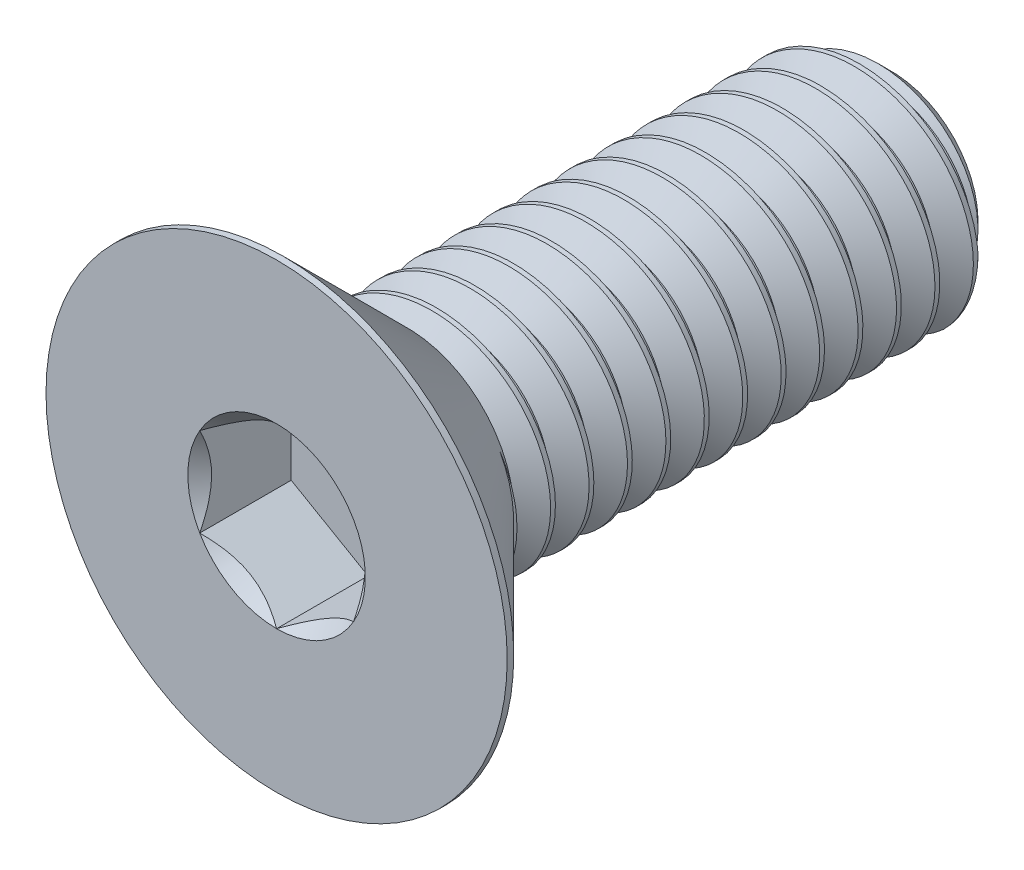
from build123d import *

# Parameters (mm, degrees)
CHAMFER1_SIZE      = 0.375
CUT_EXTRUDE2_DEPTH = 1.19
CUT_SWEEP1_PITCH   = 0.5


with BuildPart() as part:
    # Sketch1 → Revolve1 (revolve)
    with BuildSketch(Plane(origin=(0, 0, 0), x_dir=(0, 0, -1), z_dir=(1, 0, 0)), mode=Mode.PRIVATE) as revolve1_sk:
        Polygon((-2.3, 1.5), (4, 1.5), (4, 0), (-2.81, 0), (-2.81, 1.5), align=None)
    revolve(revolve1_sk.sketch.rotate(Axis((0, 0, 2.81), (0, 0, -1)), 180), axis=Axis((0, 0, 2.81), (0, 0, -1)))

    # Chamfer1
    chamfer1_edges = [part.edges().sort_by_distance(p)[0] for p in [
        (0, 1.5, -4),
    ]]
    chamfer(chamfer1_edges, length=CHAMFER1_SIZE)

    # Cut-Sweep1: the profile of Sketch13 screwed along a right-hand helix of 16 turns, 6 arcs to a turn; built about Z, then put on its axis
    cut_sweep1_z = Axis((0, 0, 0), (0, 0, 1))
    cut_sweep1_corners = [(1.527063294, 0, 0.015625), (1.527063294, 0, -0.453125), (1.175240474, 0, -0.25), (1.175240474, 0, -0.1875)]
    with BuildLine(mode=Mode.PRIVATE) as cut_sweep1_profile:
        Line(cut_sweep1_corners[0], cut_sweep1_corners[1])
        Line(cut_sweep1_corners[1], cut_sweep1_corners[2])
        Line(cut_sweep1_corners[2], cut_sweep1_corners[3])
        Line(cut_sweep1_corners[3], cut_sweep1_corners[0])
    cut_sweep1_cap = Face(cut_sweep1_profile.wire())
    cut_sweep1_turn_angles = [0, 30, 60, 90, 120, 150, 180, 210, 240, 270, 300, 330, 360]
    cut_sweep1_turn_weights = [1, 0.8660254037844387, 1, 0.8660254037844387, 1, 0.8660254037844387, 1, 0.8660254037844387, 1, 0.8660254037844387, 1, 0.8660254037844387, 1]
    cut_sweep1_turn_rails = [Edge.make_bspline([Vector(p[0], p[1], 0).rotate(cut_sweep1_z, cut_sweep1_turn_angles[k]) / cut_sweep1_turn_weights[k] + Vector(0, 0, p[2] + CUT_SWEEP1_PITCH * cut_sweep1_turn_angles[k] / 360) for k in range(13)], [0, 0, 0, 1, 1, 2, 2, 3, 3, 4, 4, 5, 5, 6, 6, 6], 2, cut_sweep1_turn_weights) for p in cut_sweep1_corners]
    cut_sweep1_turn_sides = [Face.make_surface_from_curves(cut_sweep1_turn_rails[p[0]], cut_sweep1_turn_rails[p[1]]) for p in [(0, 1), (1, 2), (2, 3), (3, 0)]]
    cut_sweep1 = Plane(origin=(0, 0, -4), x_dir=(0, 1, 0), z_dir=(0, 0, 1)) * Solid(Shell([*[p.moved(Location((0, 0, CUT_SWEEP1_PITCH * i))) for i in range(16) for p in cut_sweep1_turn_sides], cut_sweep1_cap, cut_sweep1_cap.rotate(cut_sweep1_z, 5760).moved(Location((0, 0, CUT_SWEEP1_PITCH * 5760 / 360)))]))
    add(cut_sweep1, mode=Mode.SUBTRACT)


with BuildPart() as body_2:
    # Sketch7 → Revolve2 (revolve)
    with BuildSketch(Plane(origin=(0, 0, 0), x_dir=(0, 0, -1), z_dir=(1, 0, 0)), mode=Mode.PRIVATE) as revolve2_sk:
        Polygon((-4, 3), (-3.915, 3), (-2.3, 1.385), (-2.3, 0), (-4, 0), align=None)
    revolve(revolve2_sk.sketch.rotate(Axis((0, 0, 4), (0, 0, -1)), 180), axis=Axis((0, 0, 4), (0, 0, -1)))

    # Sketch5 → Cut-Extrude2 (cut)
    with BuildSketch(Plane.XY.offset(4)):
        Polygon((1, -0.577350269), (1, 0.577350269), (0, 1.154700538), (-1, 0.577350269), (-1, -0.577350269), (0, -1.154700538), align=None)
    extrude(amount=-CUT_EXTRUDE2_DEPTH, mode=Mode.SUBTRACT)

    # Cut-Extrude3 cone 1 section (through the dimple's axis) → Cut-Extrude3 (revolve, cut)
    with BuildSketch(Plane(origin=(0, 0, 4), x_dir=(0, -1, 0), z_dir=(1, 0, 0))):
        Polygon((0, 0), (1.154700538, 0), (0, 1.154700538), align=None)
    revolve(axis=Axis((0, 0, 4), (0, 0, -1)), mode=Mode.SUBTRACT)

    # Combine1: union part
    add(part.part)


solid = body_2.part
